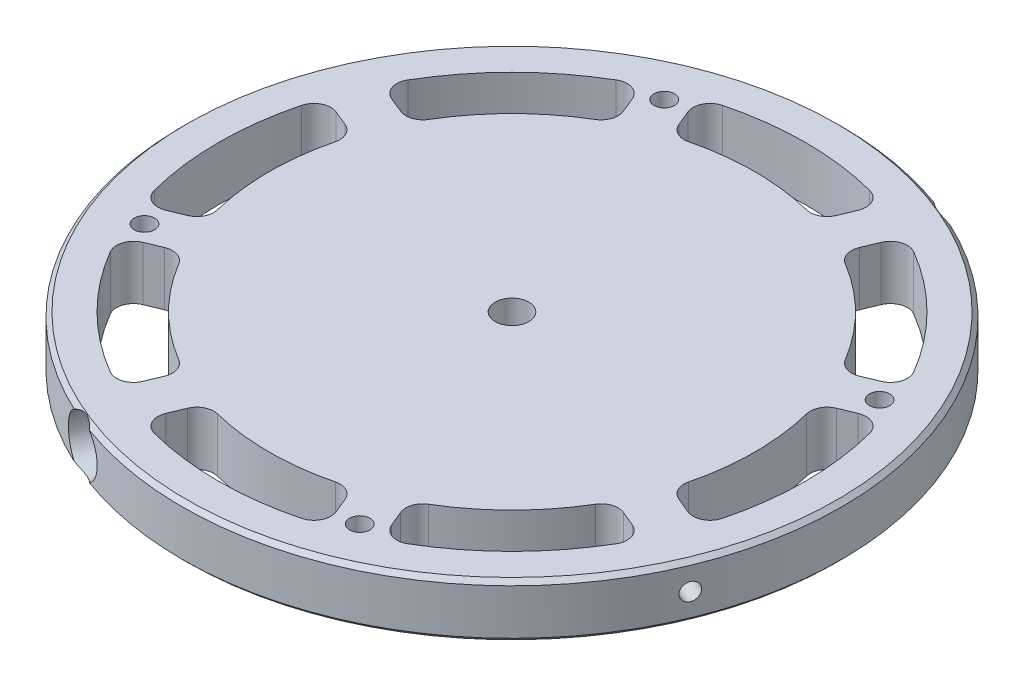
from build123d import *

# Parameters (mm, degrees)
SKETCH2_W                   = 77.55
SKETCH2_H                   = 12.7
F_12_0_189_DIAMETER_HOLE1_D = 4.8006
CIRPATTERN3_COUNT           = 4
CUT_EXTRUDE1_DEPTH          = 111.405140279
FILLET1_R                   = 4
CIRPATTERN4_COUNT           = 8
FILLET1_OF_CIRPATTERN4_R    = 4
CHAMFER1_SIZE               = 1
SKETCH15_W                  = 2.0447
SKETCH15_H                  = 101.323957926
SKETCH19_R                  = 6.25
CUT_EXTRUDE3_DEPTH          = 5
CIRPATTERN5_COUNT           = 2
CIRPATTERN6_COUNT           = 2
SKETCH22_R                  = 3.96875
CUT_EXTRUDE4_DEPTH          = 12.8


with BuildPart() as part:
    # Sketch2 → Revolve1 (revolve)
    with BuildSketch(Plane(origin=(0, 0, 0), x_dir=(0, 0, -1), z_dir=(1, 0, 0))):
        with Locations((-38.775, 6.35)):
            Rectangle(SKETCH2_W, SKETCH2_H)
    revolve(axis=Axis((0, -0.888756804, 0), (0, 1, 0)))

    # #12 (0.189) Diameter Hole1 (through all)
    with Locations(Plane(origin=(0, 12.7, 0), x_dir=(1, 0, 0), z_dir=(0, 1, 0))):
        with Locations((-25.333643223, 61.160825052)):
            f_12_0_189_diameter_hole1 = Hole(F_12_0_189_DIAMETER_HOLE1_D / 2)

    # CirPattern3: #12 (0.189) Diameter Hole1 ×4 about axis
    cirpattern3_axis = Axis((0, -0.888756804, 0), (0, 1, 0))
    for i in range(1, CIRPATTERN3_COUNT):
        add(f_12_0_189_diameter_hole1.rotate(cirpattern3_axis, i * 360 / CIRPATTERN3_COUNT), mode=Mode.SUBTRACT)

    # Sketch8 → Cut-Extrude1 (cut, through all)
    with BuildSketch(Plane(origin=(0, 12.7, 0), x_dir=(1, 0, 0), z_dir=(0, 1, 0))):
        with BuildLine():
            Line((-17.167098173, 54.510670885), (-21.735525784, 65.539830782))
            ThreePointArc((-21.735525784, 65.539830782), (0, 69.05), (21.735525784, 65.539830782))
            Line((21.735525784, 65.539830782), (17.167098173, 54.510670885))
            ThreePointArc((17.167098173, 54.510670885), (0, 57.15), (-17.167098173, 54.510670885))
        make_face()
    cut_extrude1 = extrude(amount=-CUT_EXTRUDE1_DEPTH, mode=Mode.SUBTRACT)

    # Fillet1
    fillet1_edges = [part.edges().sort_by_distance(p)[0] for p in [
        (17.167098173, 6.35, -54.510670885),
        (21.735525784, 6.35, -65.539830782),
        (-17.167098173, 6.35, -54.510670885),
        (-21.735525784, 6.35, -65.539830782),
    ]]
    fillet(fillet1_edges, radius=FILLET1_R)

    # CirPattern4: Cut-Extrude1 ×8 about axis
    cirpattern4_axis = Axis((0, -0.888756804, 0), (0, 1, 0))
    for i in range(1, CIRPATTERN4_COUNT):
        add(cut_extrude1.rotate(cirpattern4_axis, i * 360 / CIRPATTERN4_COUNT), mode=Mode.SUBTRACT)

    # Fillet1 of CirPattern4
    fillet1_of_cirpattern4_edges = [part.edges().sort_by_distance(p)[0] for p in [
        (-26.405893498, 6.35, -50.683836561),
        (-30.974321109, 6.35, -61.712996458),
        (-50.683836561, 6.35, -26.405893498),
        (-61.712996458, 6.35, -30.974321109),
        (-54.510670885, 6.35, -17.167098173),
        (-65.539830782, 6.35, -21.735525784),
        (-54.510670885, 6.35, 17.167098173),
        (-65.539830782, 6.35, 21.735525784),
        (-50.683836561, 6.35, 26.405893498),
        (-61.712996458, 6.35, 30.974321109),
        (-26.405893498, 6.35, 50.683836561),
        (-30.974321109, 6.35, 61.712996458),
        (-17.167098173, 6.35, 54.510670885),
        (-21.735525784, 6.35, 65.539830782),
        (17.167098173, 6.35, 54.510670885),
        (21.735525784, 6.35, 65.539830782),
        (26.405893498, 6.35, 50.683836561),
        (30.974321109, 6.35, 61.712996458),
        (50.683836561, 6.35, 26.405893498),
        (61.712996458, 6.35, 30.974321109),
        (54.510670885, 6.35, 17.167098173),
        (65.539830782, 6.35, 21.735525784),
        (54.510670885, 6.35, -17.167098173),
        (65.539830782, 6.35, -21.735525784),
        (50.683836561, 6.35, -26.405893498),
        (61.712996458, 6.35, -30.974321109),
        (26.405893498, 6.35, -50.683836561),
        (30.974321109, 6.35, -61.712996458),
    ]]
    fillet(fillet1_of_cirpattern4_edges, radius=FILLET1_OF_CIRPATTERN4_R)

    # Chamfer1
    chamfer1_edges = [part.edges().sort_by_distance(p)[0] for p in [
        (0, 0, -77.55),
        (0, 12.7, -77.55),
    ]]
    chamfer(chamfer1_edges, length=CHAMFER1_SIZE)

    # Sketch15 → #20 (0.161) Diameter Hole1 (revolve, cut)
    with BuildSketch(Plane(origin=(0, 6.35, 0), x_dir=(-0.38268343236508734, 0, 0.9238795325112877), z_dir=(0, 1, 0))):
        with Locations((1.02235, 50.661978963)):
            Rectangle(SKETCH15_W, SKETCH15_H)
    revolve(axis=Axis((-5.866635031, 6.35, -2.430039796), (0.9238795325112877, 0, 0.3826834323650874)), mode=Mode.SUBTRACT)

    # Sketch19 → Cut-Extrude3 (cut)
    with BuildSketch(Plane(origin=(29.67710018, 0, -71.646857746), x_dir=(-0.9238795325112891, 0, -0.38268343236508423), z_dir=(0.38268343236508423, 0, -0.9238795325112891))):
        with Locations((0, 6.35)):
            Circle(SKETCH19_R)
    cut_extrude3 = extrude(amount=-CUT_EXTRUDE3_DEPTH, mode=Mode.SUBTRACT)

    # CirPattern5: Cut-Extrude3 ×2 about axis
    cirpattern5_axis = Axis((0, -0.888756804, 0), (0, 1, 0))
    for i in range(1, CIRPATTERN5_COUNT):
        add(cut_extrude3.rotate(cirpattern5_axis, i * 360 / CIRPATTERN5_COUNT), mode=Mode.SUBTRACT)

    # Sketch21 → #10-24 Tapped Hole1 (revolve, cut)
    with BuildSketch(Plane(origin=(-27.763683018, 6.35, 67.027460084), x_dir=(0.9238795325112891, 0, 0.38268343236508423), z_dir=(0, 1, 0))):
        Polygon((0, 0), (0, 51.940824014), (1.89865, 50.8), (1.89865, 0), align=None)
    f_10_24_tapped_hole1 = revolve(axis=Axis((-30.193722814, 6.35, 72.894095115), (0.38268343236508423, 0, -0.923879532511289)), mode=Mode.SUBTRACT)

    # CirPattern6: #10-24 Tapped Hole1 ×2 about axis
    cirpattern6_axis = Axis((0, -0.888756804, 0), (0, 1, 0))
    for i in range(1, CIRPATTERN6_COUNT):
        add(f_10_24_tapped_hole1.rotate(cirpattern6_axis, i * 360 / CIRPATTERN6_COUNT), mode=Mode.SUBTRACT)

    # Sketch22 → Cut-Extrude4 (cut)
    with BuildSketch(Plane(origin=(0, 12.7, 0), x_dir=(1, 0, 0), z_dir=(0, 1, 0))):
        Circle(SKETCH22_R)
    extrude(amount=-CUT_EXTRUDE4_DEPTH, mode=Mode.SUBTRACT)


solid = part.part
